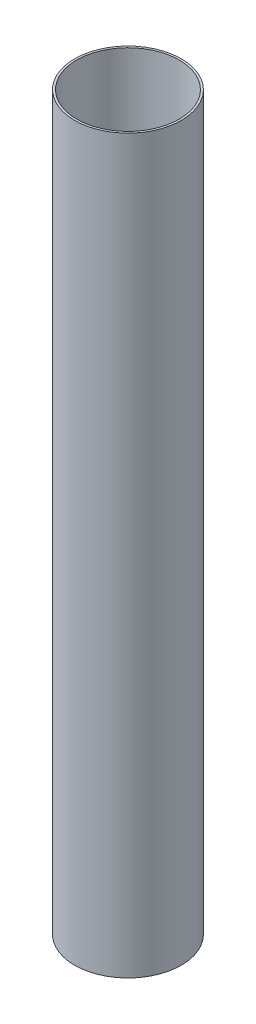
from build123d import *

# Parameters (mm, degrees)
SKETCH1_R           = 51.2
SKETCH1_R_2         = 49.2
BOSS_EXTRUDE1_DEPTH = 702


with BuildPart() as part:
    # Sketch1 → Boss-Extrude1 (new body)
    with BuildSketch(Plane(origin=(0, 0, 0), x_dir=(1, 0, 0), z_dir=(0, 1, 0))):
        Circle(SKETCH1_R)
        Circle(SKETCH1_R_2, mode=Mode.SUBTRACT)
    extrude(amount=BOSS_EXTRUDE1_DEPTH)


solid = part.part
